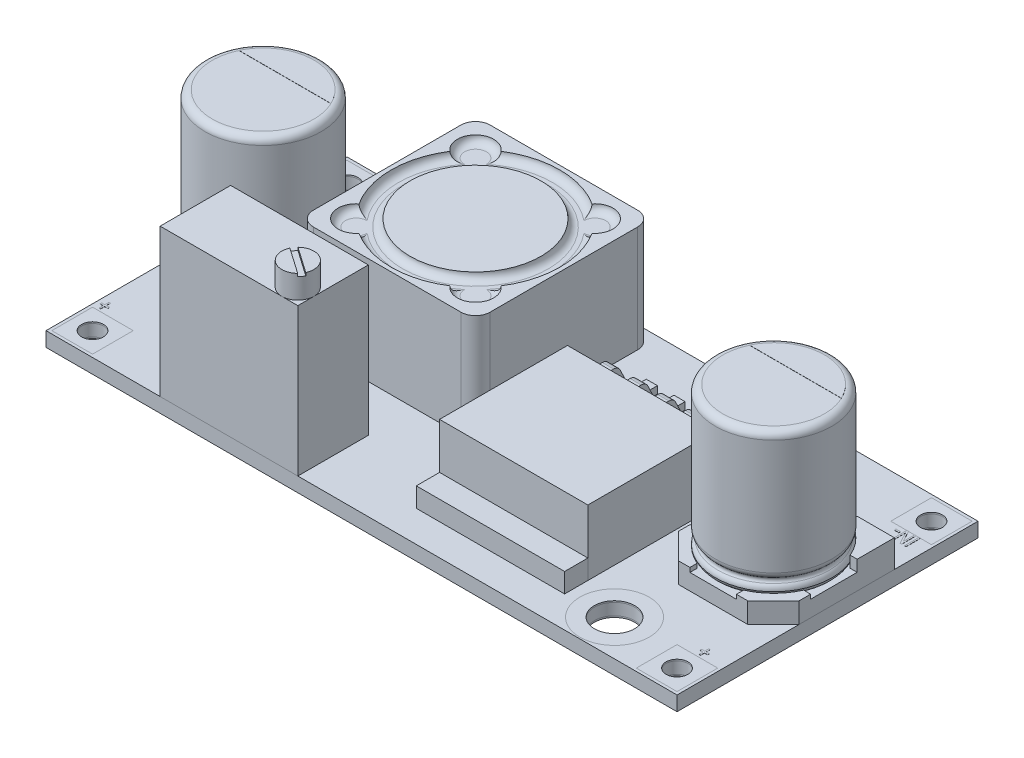
from build123d import *

# Parameters (mm, degrees)
SKETCH1_W                    = 43.4
SKETCH1_H                    = 20.7
BOSS_EXTRUDE1_DEPTH          = 1
SKETCH2_R                    = 0.75
SKETCH2_R_2                  = 1.385
CUT_EXTRUDE1_DEPTH           = 25.062678571
SKETCH2_3_R                  = 2.385
SKETCH2_3_R_2                = 1.385
SKETCH2_3_W                  = 2.8
SKETCH2_3_H                  = 2.8
SKETCH2_3_R_3                = 0.75
CUT_EXTRUDE3_DEPTH           = 0.1
CUT_EXTRUDE4_START           = -0.9
SKETCH2_4_R                  = 2.385
SKETCH2_4_R_2                = 1.385
SKETCH2_4_W                  = 2.8
SKETCH2_4_H                  = 2.8
SKETCH2_4_R_3                = 0.75
CUT_EXTRUDE4_DEPTH           = 0.1
SKETCH2_5_R                  = 2.385
SKETCH2_5_R_2                = 1.385
BOSS_EXTRUDE2_DEPTH          = 0.1
BOSS_EXTRUDE2_2_DEPTH        = 0.1
SKETCH2_5_W                  = 2.8
SKETCH2_5_H                  = 2.8
SKETCH2_5_R_3                = 0.75
BOSS_EXTRUDE2_3_DEPTH        = 0.1
BOSS_EXTRUDE2_4_DEPTH        = 0.1
BOSS_EXTRUDE2_5_DEPTH        = 0.1
BOSS_EXTRUDE2_6_DEPTH        = 0.1
BOSS_EXTRUDE3_START          = -1
SKETCH2_6_R                  = 2.385
SKETCH2_6_R_2                = 1.385
BOSS_EXTRUDE3_DEPTH          = 0.1
BOSS_EXTRUDE3_2_DEPTH        = 0.1
SKETCH2_6_W                  = 2.8
SKETCH2_6_H                  = 2.8
SKETCH2_6_R_3                = 0.75
BOSS_EXTRUDE3_3_DEPTH        = 0.1
BOSS_EXTRUDE3_4_DEPTH        = 0.1
BOSS_EXTRUDE3_5_DEPTH        = 0.1
BOSS_EXTRUDE3_6_DEPTH        = 0.1
SKETCH3_R                    = 4
BOSS_EXTRUDE4_DEPTH          = 1.89
CUT_EXTRUDE5_START           = 1.89
SKETCH3_3_R                  = 4
CUT_EXTRUDE5_DEPTH           = 0.78
CUT_EXTRUDE6_DEPTH           = 0.78
BOSS_EXTRUDE5_START          = 1.11
SKETCH3_4_R                  = 4
BOSS_EXTRUDE5_DEPTH          = 9.92
FILLET1_R                    = 0.5
CUT_EXTRUDE7_DEPTH           = 0.48
SKETCH9_R                    = 0.25
FILLET2_R                    = 0.5
FILLET3_R                    = 0.5
BOSS_EXTRUDE6_DEPTH          = 0.01
BOSS_EXTRUDE7_DEPTH          = 7.32
SKETCH13_R                   = 4.5
CUT_EXTRUDE8_DEPTH           = 0.5
FILLET4_R                    = 0.5
FILLET5_R                    = 0.5
SKETCH14_W                   = 9.47
SKETCH14_H                   = 4.85
BOSS_EXTRUDE8_DEPTH          = 10.15
SKETCH15_R                   = 1.1
BOSS_EXTRUDE9_DEPTH          = 1.6
CUT_EXTRUDE9_DEPTH           = 0.2
SKETCH17_W                   = 10.2
SKETCH17_H                   = 8.8
BOSS_EXTRUDE10_DEPTH         = 4.5
SKETCH17_3_W                 = 10.2
SKETCH17_3_H                 = 1.6
BOSS_EXTRUDE11_DEPTH         = 1.34
EXTRUDE_THIN1_START          = -1.1
EXTRUDE_THIN1_DEPTH          = 0.77
LPATTERN1_COUNT              = 5
LPATTERN1_PITCH              = 1.90375
SKETCH19_W                   = 4.02
SKETCH19_H                   = 2.56
BOSS_EXTRUDE12_DEPTH         = 2.3
EXTRUDE_THIN2_START          = -2
EXTRUDE_THIN2_DEPTH          = 1.4
EXTRUDE_THIN3_START          = -0.6
EXTRUDE_THIN3_DEPTH          = 1.4
BOSS_EXTRUDE13_START         = 6.518831169
BOSS_EXTRUDE13_OUTLINE_W     = 0.103896104
BOSS_EXTRUDE13_OUTLINE_H     = 0.01
BOSS_EXTRUDE13_DEPTH         = 0.662337662
BOSS_EXTRUDE13_START_2       = 6.791558442
BOSS_EXTRUDE13_2_OUTLINE_W   = 0.22077922
BOSS_EXTRUDE13_2_OUTLINE_H   = 0.01
BOSS_EXTRUDE13_2_OUTLINE_W_2 = 0.220779221
BOSS_EXTRUDE13_2_DEPTH       = 0.116883116
BOSS_EXTRUDE13_START_3       = -7.051298701
BOSS_EXTRUDE13_3_OUTLINE_W   = 0.311688311
BOSS_EXTRUDE13_3_OUTLINE_H   = 0.01
BOSS_EXTRUDE13_3_DEPTH       = 0.116883117
BOSS_EXTRUDE13_START_4       = -7.35
BOSS_EXTRUDE13_4_OUTLINE_W   = 0.103896104
BOSS_EXTRUDE13_4_OUTLINE_H   = 0.01
BOSS_EXTRUDE13_4_DEPTH       = 1
BOSS_EXTRUDE13_START_5       = -6.466883117
BOSS_EXTRUDE13_5_OUTLINE_W   = 0.272727273
BOSS_EXTRUDE13_5_OUTLINE_H   = 0.01
BOSS_EXTRUDE13_5_DEPTH       = 0.116883117
BOSS_EXTRUDE13_START_6       = 1
BOSS_EXTRUDE13_6_DEPTH       = 0.01
BOSS_EXTRUDE13_7_DEPTH       = 0.01
BOSS_EXTRUDE13_8_OUTLINE_W   = 0.103896104
BOSS_EXTRUDE13_8_OUTLINE_H   = 0.01
BOSS_EXTRUDE13_8_DEPTH       = 1
BOSS_EXTRUDE13_9_DEPTH       = 0.01
BOSS_EXTRUDE13_10_OUTLINE_W  = 0.311688311
BOSS_EXTRUDE13_10_OUTLINE_H  = 0.01
BOSS_EXTRUDE13_10_DEPTH      = 0.116883117
BOSS_EXTRUDE13_11_OUTLINE_W  = 0.103896104
BOSS_EXTRUDE13_11_OUTLINE_H  = 0.01
BOSS_EXTRUDE13_11_DEPTH      = 0.662337662
BOSS_EXTRUDE13_12_OUTLINE_W  = 0.220779221
BOSS_EXTRUDE13_12_OUTLINE_H  = 0.01
BOSS_EXTRUDE13_12_DEPTH      = 0.116883116


with BuildPart() as part:
    # Sketch1 → Boss-Extrude1 (new body)
    with BuildSketch(Plane(origin=(0, 0, 0), x_dir=(1, 0, 0), z_dir=(0, 1, 0))):
        Rectangle(SKETCH1_W, SKETCH1_H)
    extrude(amount=BOSS_EXTRUDE1_DEPTH)

    # Sketch2 → Cut-Extrude1 (cut, through all)
    with BuildSketch(Plane(origin=(0, 1, 0), x_dir=(1, 0, 0), z_dir=(0, 1, 0))):
        with Locations(Location((-20.1, 8.75, 0), (0, 0, 270))):
            Circle(SKETCH2_R)
        with Locations(Location((-15.415, 7.865, 0), (0, 0, 270))):
            Circle(SKETCH2_R_2)
        with Locations(Location((-20.1, -8.75, 0), (0, 0, 270))):
            Circle(SKETCH2_R)
        with Locations(Location((20.1, 8.75, 0), (0, 0, 270))):
            Circle(SKETCH2_R)
        with Locations(Location((14.915, -7.865, 0), (0, 0, 270))):
            Circle(SKETCH2_R_2)
        with Locations(Location((20.1, -8.75, 0), (0, 0, 270))):
            Circle(SKETCH2_R)
    extrude(amount=-CUT_EXTRUDE1_DEPTH, mode=Mode.SUBTRACT)

    # Sketch2<3> → Cut-Extrude3 (cut)
    # profile 1 of 6: a face of its own
    with BuildSketch(Plane(origin=(0, 1, 0), x_dir=(1, 0, 0), z_dir=(0, 1, 0))):
        with Locations(Location((14.915, -7.865, 0), (0, 0, 270))):
            Circle(SKETCH2_3_R)
        with Locations(Location((14.915, -7.865, 0), (0, 0, 270))):
            Circle(SKETCH2_3_R_2, mode=Mode.SUBTRACT)
    # profile 2 of 6: a face of its own
    with BuildSketch(Plane(origin=(0, 1, 0), x_dir=(1, 0, 0), z_dir=(0, 1, 0))):
        with Locations(Location((-15.415, 7.865, 0), (0, 0, 270))):
            Circle(SKETCH2_3_R)
        with Locations(Location((-15.415, 7.865, 0), (0, 0, 270))):
            Circle(SKETCH2_3_R_2, mode=Mode.SUBTRACT)
    # profile 3 of 6: a face of its own
    with BuildSketch(Plane(origin=(0, 1, 0), x_dir=(1, 0, 0), z_dir=(0, 1, 0))):
        with Locations((-20.1, 8.75)):
            Rectangle(SKETCH2_3_W, SKETCH2_3_H)
        with Locations(Location((-20.1, 8.75, 0), (0, 0, 270))):
            Circle(SKETCH2_3_R_3, mode=Mode.SUBTRACT)
    # profile 4 of 6: a face of its own
    with BuildSketch(Plane(origin=(0, 1, 0), x_dir=(1, 0, 0), z_dir=(0, 1, 0))):
        with Locations((-20.1, -8.75)):
            Rectangle(SKETCH2_3_W, SKETCH2_3_H)
        with Locations(Location((-20.1, -8.75, 0), (0, 0, 270))):
            Circle(SKETCH2_3_R_3, mode=Mode.SUBTRACT)
    # profile 5 of 6: a face of its own
    with BuildSketch(Plane(origin=(0, 1, 0), x_dir=(1, 0, 0), z_dir=(0, 1, 0))):
        with Locations((20.1, -8.75)):
            Rectangle(SKETCH2_3_W, SKETCH2_3_H)
        with Locations(Location((20.1, -8.75, 0), (0, 0, 270))):
            Circle(SKETCH2_3_R_3, mode=Mode.SUBTRACT)
    # profile 6 of 6: a face of its own
    with BuildSketch(Plane(origin=(0, 1, 0), x_dir=(1, 0, 0), z_dir=(0, 1, 0))):
        with Locations((20.1, 8.75)):
            Rectangle(SKETCH2_3_W, SKETCH2_3_H)
        with Locations(Location((20.1, 8.75, 0), (0, 0, 270))):
            Circle(SKETCH2_3_R_3, mode=Mode.SUBTRACT)
    extrude(amount=-CUT_EXTRUDE3_DEPTH, mode=Mode.SUBTRACT)

    # Sketch2<4> → Cut-Extrude4 (cut)
    # profile 1 of 6: a face of its own
    with BuildSketch(Plane(origin=(0, 1, 0), x_dir=(1, 0, 0), z_dir=(0, 1, 0)).offset(CUT_EXTRUDE4_START)):
        with Locations(Location((14.915, -7.865, 0), (0, 0, 270))):
            Circle(SKETCH2_4_R)
        with Locations(Location((14.915, -7.865, 0), (0, 0, 270))):
            Circle(SKETCH2_4_R_2, mode=Mode.SUBTRACT)
    # profile 2 of 6: a face of its own
    with BuildSketch(Plane(origin=(0, 1, 0), x_dir=(1, 0, 0), z_dir=(0, 1, 0)).offset(CUT_EXTRUDE4_START)):
        with Locations(Location((-15.415, 7.865, 0), (0, 0, 270))):
            Circle(SKETCH2_4_R)
        with Locations(Location((-15.415, 7.865, 0), (0, 0, 270))):
            Circle(SKETCH2_4_R_2, mode=Mode.SUBTRACT)
    # profile 3 of 6: a face of its own
    with BuildSketch(Plane(origin=(0, 1, 0), x_dir=(1, 0, 0), z_dir=(0, 1, 0)).offset(CUT_EXTRUDE4_START)):
        with Locations((-20.1, 8.75)):
            Rectangle(SKETCH2_4_W, SKETCH2_4_H)
        with Locations(Location((-20.1, 8.75, 0), (0, 0, 270))):
            Circle(SKETCH2_4_R_3, mode=Mode.SUBTRACT)
    # profile 4 of 6: a face of its own
    with BuildSketch(Plane(origin=(0, 1, 0), x_dir=(1, 0, 0), z_dir=(0, 1, 0)).offset(CUT_EXTRUDE4_START)):
        with Locations((-20.1, -8.75)):
            Rectangle(SKETCH2_4_W, SKETCH2_4_H)
        with Locations(Location((-20.1, -8.75, 0), (0, 0, 270))):
            Circle(SKETCH2_4_R_3, mode=Mode.SUBTRACT)
    # profile 5 of 6: a face of its own
    with BuildSketch(Plane(origin=(0, 1, 0), x_dir=(1, 0, 0), z_dir=(0, 1, 0)).offset(CUT_EXTRUDE4_START)):
        with Locations((20.1, -8.75)):
            Rectangle(SKETCH2_4_W, SKETCH2_4_H)
        with Locations(Location((20.1, -8.75, 0), (0, 0, 270))):
            Circle(SKETCH2_4_R_3, mode=Mode.SUBTRACT)
    # profile 6 of 6: a face of its own
    with BuildSketch(Plane(origin=(0, 1, 0), x_dir=(1, 0, 0), z_dir=(0, 1, 0)).offset(CUT_EXTRUDE4_START)):
        with Locations((20.1, 8.75)):
            Rectangle(SKETCH2_4_W, SKETCH2_4_H)
        with Locations(Location((20.1, 8.75, 0), (0, 0, 270))):
            Circle(SKETCH2_4_R_3, mode=Mode.SUBTRACT)
    extrude(amount=-CUT_EXTRUDE4_DEPTH, mode=Mode.SUBTRACT)


with BuildPart() as body_2:
    # Sketch2<5> → Boss-Extrude2 (new body)
    with BuildSketch(Plane(origin=(0, 1, 0), x_dir=(1, 0, 0), z_dir=(0, 1, 0))):
        with Locations(Location((14.915, -7.865, 0), (0, 0, 270))):
            Circle(SKETCH2_5_R)
        with Locations(Location((14.915, -7.865, 0), (0, 0, 270))):
            Circle(SKETCH2_5_R_2, mode=Mode.SUBTRACT)
    extrude(amount=-BOSS_EXTRUDE2_DEPTH)


with BuildPart() as body_3:
    # Sketch2<5> → Boss-Extrude2 2 (new body)
    with BuildSketch(Plane(origin=(0, 1, 0), x_dir=(1, 0, 0), z_dir=(0, 1, 0))):
        with Locations(Location((-15.415, 7.865, 0), (0, 0, 270))):
            Circle(SKETCH2_5_R)
        with Locations(Location((-15.415, 7.865, 0), (0, 0, 270))):
            Circle(SKETCH2_5_R_2, mode=Mode.SUBTRACT)
    extrude(amount=-BOSS_EXTRUDE2_2_DEPTH)


with BuildPart() as body_4:
    # Sketch2<5> → Boss-Extrude2 3 (new body)
    with BuildSketch(Plane(origin=(0, 1, 0), x_dir=(1, 0, 0), z_dir=(0, 1, 0))):
        with Locations((-20.1, 8.75)):
            Rectangle(SKETCH2_5_W, SKETCH2_5_H)
        with Locations(Location((-20.1, 8.75, 0), (0, 0, 270))):
            Circle(SKETCH2_5_R_3, mode=Mode.SUBTRACT)
    extrude(amount=-BOSS_EXTRUDE2_3_DEPTH)


with BuildPart() as body_5:
    # Sketch2<5> → Boss-Extrude2 4 (new body)
    with BuildSketch(Plane(origin=(0, 1, 0), x_dir=(1, 0, 0), z_dir=(0, 1, 0))):
        with Locations((-20.1, -8.75)):
            Rectangle(SKETCH2_5_W, SKETCH2_5_H)
        with Locations(Location((-20.1, -8.75, 0), (0, 0, 270))):
            Circle(SKETCH2_5_R_3, mode=Mode.SUBTRACT)
    extrude(amount=-BOSS_EXTRUDE2_4_DEPTH)


with BuildPart() as body_6:
    # Sketch2<5> → Boss-Extrude2 5 (new body)
    with BuildSketch(Plane(origin=(0, 1, 0), x_dir=(1, 0, 0), z_dir=(0, 1, 0))):
        with Locations((20.1, -8.75)):
            Rectangle(SKETCH2_5_W, SKETCH2_5_H)
        with Locations(Location((20.1, -8.75, 0), (0, 0, 270))):
            Circle(SKETCH2_5_R_3, mode=Mode.SUBTRACT)
    extrude(amount=-BOSS_EXTRUDE2_5_DEPTH)


with BuildPart() as body_7:
    # Sketch2<5> → Boss-Extrude2 6 (new body)
    with BuildSketch(Plane(origin=(0, 1, 0), x_dir=(1, 0, 0), z_dir=(0, 1, 0))):
        with Locations((20.1, 8.75)):
            Rectangle(SKETCH2_5_W, SKETCH2_5_H)
        with Locations(Location((20.1, 8.75, 0), (0, 0, 270))):
            Circle(SKETCH2_5_R_3, mode=Mode.SUBTRACT)
    extrude(amount=-BOSS_EXTRUDE2_6_DEPTH)


with BuildPart() as body_8:
    # Sketch2<6> → Boss-Extrude3 (new body)
    with BuildSketch(Plane(origin=(0, 1, 0), x_dir=(1, 0, 0), z_dir=(0, 1, 0)).offset(BOSS_EXTRUDE3_START)):
        with Locations(Location((14.915, -7.865, 0), (0, 0, 270))):
            Circle(SKETCH2_6_R)
        with Locations(Location((14.915, -7.865, 0), (0, 0, 270))):
            Circle(SKETCH2_6_R_2, mode=Mode.SUBTRACT)
    extrude(amount=BOSS_EXTRUDE3_DEPTH)


with BuildPart() as body_9:
    # Sketch2<6> → Boss-Extrude3 2 (new body)
    with BuildSketch(Plane(origin=(0, 1, 0), x_dir=(1, 0, 0), z_dir=(0, 1, 0)).offset(BOSS_EXTRUDE3_START)):
        with Locations(Location((-15.415, 7.865, 0), (0, 0, 270))):
            Circle(SKETCH2_6_R)
        with Locations(Location((-15.415, 7.865, 0), (0, 0, 270))):
            Circle(SKETCH2_6_R_2, mode=Mode.SUBTRACT)
    extrude(amount=BOSS_EXTRUDE3_2_DEPTH)


with BuildPart() as body_10:
    # Sketch2<6> → Boss-Extrude3 3 (new body)
    with BuildSketch(Plane(origin=(0, 1, 0), x_dir=(1, 0, 0), z_dir=(0, 1, 0)).offset(BOSS_EXTRUDE3_START)):
        with Locations((-20.1, 8.75)):
            Rectangle(SKETCH2_6_W, SKETCH2_6_H)
        with Locations(Location((-20.1, 8.75, 0), (0, 0, 270))):
            Circle(SKETCH2_6_R_3, mode=Mode.SUBTRACT)
    extrude(amount=BOSS_EXTRUDE3_3_DEPTH)


with BuildPart() as body_11:
    # Sketch2<6> → Boss-Extrude3 4 (new body)
    with BuildSketch(Plane(origin=(0, 1, 0), x_dir=(1, 0, 0), z_dir=(0, 1, 0)).offset(BOSS_EXTRUDE3_START)):
        with Locations((-20.1, -8.75)):
            Rectangle(SKETCH2_6_W, SKETCH2_6_H)
        with Locations(Location((-20.1, -8.75, 0), (0, 0, 270))):
            Circle(SKETCH2_6_R_3, mode=Mode.SUBTRACT)
    extrude(amount=BOSS_EXTRUDE3_4_DEPTH)


with BuildPart() as body_12:
    # Sketch2<6> → Boss-Extrude3 5 (new body)
    with BuildSketch(Plane(origin=(0, 1, 0), x_dir=(1, 0, 0), z_dir=(0, 1, 0)).offset(BOSS_EXTRUDE3_START)):
        with Locations((20.1, -8.75)):
            Rectangle(SKETCH2_6_W, SKETCH2_6_H)
        with Locations(Location((20.1, -8.75, 0), (0, 0, 270))):
            Circle(SKETCH2_6_R_3, mode=Mode.SUBTRACT)
    extrude(amount=BOSS_EXTRUDE3_5_DEPTH)


with BuildPart() as body_13:
    # Sketch2<6> → Boss-Extrude3 6 (new body)
    with BuildSketch(Plane(origin=(0, 1, 0), x_dir=(1, 0, 0), z_dir=(0, 1, 0)).offset(BOSS_EXTRUDE3_START)):
        with Locations((20.1, 8.75)):
            Rectangle(SKETCH2_6_W, SKETCH2_6_H)
        with Locations(Location((20.1, 8.75, 0), (0, 0, 270))):
            Circle(SKETCH2_6_R_3, mode=Mode.SUBTRACT)
    extrude(amount=BOSS_EXTRUDE3_6_DEPTH)


with BuildPart() as body_14:
    # Sketch3 → Boss-Extrude4 (new body)
    # profile 1 of 2: a face of its own
    with BuildSketch(Plane(origin=(0, 1, 0), x_dir=(1, 0, 0), z_dir=(0, 1, 0))):
        Polygon((21.7, 4.6), (13.41, 4.6), (13.41, -1.952233047), (15.177766953, -3.72), (19.932233047, -3.72), (21.7, -1.952233047), align=None)
        with Locations((17.555, 0.44)):
            Circle(SKETCH3_R, mode=Mode.SUBTRACT)
    # profile 2 of 2: a face of its own
    with BuildSketch(Plane(origin=(0, 1, 0), x_dir=(1, 0, 0), z_dir=(0, 1, 0))):
        with Locations((17.555, 0.44)):
            Circle(SKETCH3_R)
    extrude(amount=BOSS_EXTRUDE4_DEPTH)

    # Sketch3<3> → Cut-Extrude5 (cut)
    with BuildSketch(Plane(origin=(0, 1, 0), x_dir=(1, 0, 0), z_dir=(0, 1, 0)).offset(CUT_EXTRUDE5_START)):
        with Locations(Location((17.555, 0.44, 0), (0, 0, 270))):
            Circle(SKETCH3_3_R)
    extrude(amount=-CUT_EXTRUDE5_DEPTH, mode=Mode.SUBTRACT)

    # Sketch4 → Cut-Extrude6 (cut)
    with BuildSketch(Plane(origin=(0, 2.89, 0), x_dir=(1, 0, 0), z_dir=(0, 1, 0))):
        Polygon((15.955, 4.6), (19.155, 4.6), (19.155, 2.04), (21.7, 2.04), (21.7, -1.16), (19.155, -1.16), (19.155, -3.72), (15.955, -3.72), (15.955, -1.16), (13.41, -1.16), (13.41, 2.04), (15.955, 2.04), align=None)
    extrude(amount=-CUT_EXTRUDE6_DEPTH, mode=Mode.SUBTRACT)

    # Sketch5 → Cut-Extrude7 (cut)
    with BuildSketch(Plane(origin=(0, 2.89, 0), x_dir=(1, 0, 0), z_dir=(0, 1, 0))):
        with BuildLine():
            Line((19.155, -3.226060556), (19.155, -3.72))
            Line((19.155, -3.72), (19.932233047, -3.72))
            Line((19.932233047, -3.72), (21.7, -1.952233047))
            Line((21.7, -1.952233047), (21.7, -1.16))
            Line((21.7, -1.16), (21.221060556, -1.16))
            ThreePointArc((21.221060556, -1.16), (20.383427125, -2.388427125), (19.155, -3.226060556))
        make_face()
        with BuildLine():
            Line((13.888939444, -1.16), (13.41, -1.16))
            Line((13.41, -1.16), (13.41, -1.952233047))
            Line((13.41, -1.952233047), (15.177766953, -3.72))
            Line((15.177766953, -3.72), (15.955, -3.72))
            Line((15.955, -3.72), (15.955, -3.226060556))
            ThreePointArc((15.955, -3.226060556), (14.726572875, -2.388427125), (13.888939444, -1.16))
        make_face()
    extrude(amount=-CUT_EXTRUDE7_DEPTH, mode=Mode.SUBTRACT)


with BuildPart() as body_15:
    # Sketch3<4> → Boss-Extrude5 (new body)
    with BuildSketch(Plane(origin=(0, 1, 0), x_dir=(1, 0, 0), z_dir=(0, 1, 0)).offset(BOSS_EXTRUDE5_START)):
        with Locations(Location((17.555, 0.44, 0), (0, 0, 270))):
            Circle(SKETCH3_4_R)
    extrude(amount=BOSS_EXTRUDE5_DEPTH)

    # Fillet1
    fillet1_edges = [body_15.edges().sort_by_distance(p)[0] for p in [
        (17.555, 12.03, -4.44),
    ]]
    fillet(fillet1_edges, radius=FILLET1_R)

    # Cut-Sweep2: sweep along a path in Sketch10
    with BuildLine(Plane(origin=(0, 3.065409261, 0), x_dir=(1, 0, 0), z_dir=(0, 1, 0))) as cut_sweep2_path:
        CenterArc((17.555, 0.44), 4, 0, 360)
    # Sketch9 → Cut-Sweep2 (sweep, cut)
    with BuildSketch(Plane.XY.offset(-0.44)):
        with Locations((21.555, 3.065409261)):
            Circle(SKETCH9_R)
    sweep(path=cut_sweep2_path.line, mode=Mode.SUBTRACT)

    # Fillet2
    fillet2_edges = [body_15.edges().sort_by_distance(p)[0] for p in [
        (14.726572875, 2.815409261, -3.268427125),
        (14.726572875, 3.315409261, -3.268427125),
    ]]
    fillet(fillet2_edges, radius=FILLET2_R)

    # Fillet3
    # the kernel refuses this fillet: 0.5 mm, written as the material it takes off along each edge
    with BuildSketch(Plane(origin=(17.555, 2.11, -0.44), x_dir=(0, 0, 1), z_dir=(-1, 0, 0))) as fillet3_piece_1:
        with BuildLine():
            CenterArc((3.51085125, 0.5), FILLET3_R, 270, 78.040778801)
            Line((3.51085125, 0), (3.51085125, -0.01))
            Line((3.51085125, -0.01), (4, -0.01))
            Line((4, -0.01), (4.01, 0))
            ThreePointArc((4.01, 0), (4.01, 0.198196133), (4.009781868, 0.394320112))
            Line((4.009781868, 0.394320112), (3.999998914, 0.396392267))
        make_face()
    fillet3_piece_1_solid = revolve(axis=Axis((17.555, 2.11, -0.44), (0, 1, 0)), revolution_arc=89.999998435, mode=Mode.PRIVATE)
    with BuildSketch(Plane(origin=(17.555, 2.11, -0.44), x_dir=(0.9999999999999997, 0, 2.7307804489895576e-08), z_dir=(-2.7307804489895576e-08, 0, 0.9999999999999997))) as fillet3_piece_2:
        with BuildLine():
            CenterArc((3.510844986, 0.5), FILLET3_R, 270, 78.040778801)
            Line((3.510844986, 0), (3.510844986, -0.01))
            Line((3.510844986, -0.01), (4, -0.01))
            Line((4, -0.01), (4.01, 0))
            ThreePointArc((4.01, 0), (4.01, 0.198196133), (4.009775603, 0.394320112))
            Line((4.009775603, 0.394320112), (3.99999265, 0.396392267))
        make_face()
    fillet3_piece_2_solid = revolve(axis=Axis((17.555, 2.11, -0.44), (0, 1, 0)), revolution_arc=270.000001565, mode=Mode.PRIVATE)
    add([fillet3_piece_1_solid, fillet3_piece_2_solid], mode=Mode.SUBTRACT)


with BuildPart() as body_16:
    # Sketch11 → Boss-Extrude6 (new body)
    with BuildSketch(Plane(origin=(0, 12.03, 0), x_dir=(1, 0, 0), z_dir=(0, 1, 0))):
        with BuildLine():
            Line((14.39272234, 1.94), (20.71727766, 1.94))
            ThreePointArc((20.71727766, 1.94), (17.555, 3.94), (14.39272234, 1.94))
        make_face()
    extrude(amount=BOSS_EXTRUDE6_DEPTH)


with BuildPart() as body_17:
    # Mirror1: mirrored copy
    add(body_14.part.mirror(Plane(origin=(0, 0, 0), x_dir=(0, 0, 1), z_dir=(1, 0, 0))))


with BuildPart() as body_18:
    # Mirror2: mirrored copy
    add(body_15.part.mirror(Plane(origin=(0, 0, 0), x_dir=(0, 0, 1), z_dir=(1, 0, 0))))


with BuildPart() as body_19:
    # Mirror2 2: mirrored copy
    add(body_16.part.mirror(Plane(origin=(0, 0, 0), x_dir=(0, 0, 1), z_dir=(1, 0, 0))))


with BuildPart() as body_20:
    # Sketch12 → Boss-Extrude7 (new body)
    with BuildSketch(Plane(origin=(0, 1, 0), x_dir=(1, 0, 0), z_dir=(0, 1, 0))):
        with BuildLine():
            Line((-11.36, 9.85), (-1.21, 9.85))
            ThreePointArc((-1.21, 9.85), (-0.502893219, 9.557106781), (-0.21, 8.85))
            Line((-0.21, 8.85), (-0.21, -1.3))
            ThreePointArc((-0.21, -1.3), (-0.502893219, -2.007106781), (-1.21, -2.3))
            Line((-1.21, -2.3), (-11.36, -2.3))
            ThreePointArc((-11.36, -2.3), (-12.067106781, -2.007106781), (-12.36, -1.3))
            Line((-12.36, -1.3), (-12.36, 8.85))
            ThreePointArc((-12.36, 8.85), (-12.067106781, 9.557106781), (-11.36, 9.85))
        make_face()
    extrude(amount=BOSS_EXTRUDE7_DEPTH)

    # Sketch13 → Cut-Extrude8 (cut)
    with BuildSketch(Plane(origin=(0, 8.32, 0), x_dir=(1, 0, 0), z_dir=(0, 1, 0))):
        with BuildLine():
            ThreePointArc((-1.400290034, 6.902236567), (-1.299897193, 8.760102807), (-3.157763433, 8.659709966))
            ThreePointArc((-3.157763433, 8.659709966), (-6.285, 9.575), (-9.412236567, 8.659709966))
            ThreePointArc((-9.412236567, 8.659709966), (-11.270102807, 8.760102807), (-11.169709966, 6.902236567))
            ThreePointArc((-11.169709966, 6.902236567), (-12.085, 3.775), (-11.169709966, 0.647763433))
            ThreePointArc((-11.169709966, 0.647763433), (-11.270102807, -1.210102807), (-9.412236567, -1.109709966))
            ThreePointArc((-9.412236567, -1.109709966), (-6.285, -2.025), (-3.157763433, -1.109709966))
            ThreePointArc((-3.157763433, -1.109709966), (-1.299897193, -1.210102807), (-1.400290034, 0.647763433))
            ThreePointArc((-1.400290034, 0.647763433), (-0.485, 3.775), (-1.400290034, 6.902236567))
        make_face()
        with Locations(Location((-6.285, 3.775, 0), (0, 0, 270))):
            Circle(SKETCH13_R, mode=Mode.SUBTRACT)
    extrude(amount=-CUT_EXTRUDE8_DEPTH, mode=Mode.SUBTRACT)

    # Fillet4
    fillet4_edges = [body_20.edges().sort_by_distance(p)[0] for p in [
        (-6.285, 7.82, -8.275),
    ]]
    fillet(fillet4_edges, radius=FILLET4_R - 0.0001)  # a hair under: the kernel refuses the full size

    # Fillet5
    fillet5_edges = [body_20.edges().sort_by_distance(p)[0] for p in [
        (-6.285, 7.82, 2.025),
        (-1.299897193, 7.82, 1.210102807),
        (-11.270102807, 7.82, 1.210102807),
        (-12.085, 7.82, -3.775),
        (-11.270102807, 7.82, -8.760102807),
        (-6.285, 7.82, -9.575),
        (-1.299897193, 7.82, -8.760102807),
        (-0.485, 7.82, -3.775),
    ]]
    fillet(fillet5_edges, radius=FILLET5_R - 0.0001)  # a hair under: the kernel refuses the full size


with BuildPart() as body_21:
    # Sketch14 → Boss-Extrude8 (new body)
    with BuildSketch(Plane(origin=(0, 1, 0), x_dir=(1, 0, 0), z_dir=(0, 1, 0))):
        with Locations((-9.115, -7.925)):
            Rectangle(SKETCH14_W, SKETCH14_H)
    extrude(amount=BOSS_EXTRUDE8_DEPTH)


with BuildPart() as body_22:
    # Sketch15 → Boss-Extrude9 (new body)
    with BuildSketch(Plane(origin=(0, 11.15, 0), x_dir=(1, 0, 0), z_dir=(0, 1, 0))):
        with Locations(Location((-5.48, -9.25, 0), (0, 0, 270))):
            Circle(SKETCH15_R)
    extrude(amount=BOSS_EXTRUDE9_DEPTH)

    # Sketch16 → Cut-Extrude9 (cut)
    with BuildSketch(Plane(origin=(0, 12.75, 0), x_dir=(1, 0, 0), z_dir=(0, 1, 0))):
        with BuildLine():
            Line((-6.481845846, -8.795792008), (-4.70680547, -10.032413074))
            ThreePointArc((-4.70680547, -10.032413074), (-4.577436025, -9.878791119), (-4.478154154, -9.704207992))
            Line((-4.478154154, -9.704207992), (-6.25319453, -8.467586926))
            ThreePointArc((-6.25319453, -8.467586926), (-6.382563975, -8.621208881), (-6.481845846, -8.795792008))
        make_face()
    extrude(amount=-CUT_EXTRUDE9_DEPTH, mode=Mode.SUBTRACT)


with BuildPart() as body_23:
    # Sketch17 → Boss-Extrude10 (new body)
    with BuildSketch(Plane(origin=(0, 1, 0), x_dir=(1, 0, 0), z_dir=(0, 1, 0))):
        with Locations((6.717868164, -2.2)):
            Rectangle(SKETCH17_W, SKETCH17_H)
    extrude(amount=BOSS_EXTRUDE10_DEPTH)


with BuildPart() as body_24:
    # Sketch17<3> → Boss-Extrude11 (new body)
    with BuildSketch(Plane(origin=(0, 1, 0), x_dir=(1, 0, 0), z_dir=(0, 1, 0))):
        with Locations((6.717868164, -7.4)):
            Rectangle(SKETCH17_3_W, SKETCH17_3_H)
    extrude(amount=BOSS_EXTRUDE11_DEPTH)


with BuildPart() as body_25:
    # Sketch18 → Extrude-Thin1 (new body)
    with BuildSketch(Plane(origin=(11.817868164, 0, 0), x_dir=(0, 0, -1), z_dir=(1, 0, 0)).offset(EXTRUDE_THIN1_START)):
        with BuildLine():
            Line((2.2, 4), (3.885383015, 4))
            ThreePointArc((3.885383015, 4), (4.151669734, 3.923191899), (4.336144544, 3.716365534))
            Line((4.336144544, 3.716365534), (5.263855456, 1.783634466))
            ThreePointArc((5.263855456, 1.783634466), (5.448330266, 1.576808101), (5.714616985, 1.5))
            Line((5.714616985, 1.5), (6.9, 1.5))
            Line((6.9, 1.5), (6.9, 1))
            Line((6.9, 1), (5.714616985, 1))
            ThreePointArc((5.714616985, 1), (5.182043548, 1.153616202), (4.813093927, 1.567268932))
            Line((4.813093927, 1.567268932), (3.885383015, 3.5))
            Line((3.885383015, 3.5), (2.2, 3.5))
            Line((2.2, 3.5), (2.2, 4))
        make_face()
    extrude_thin1 = extrude(amount=-EXTRUDE_THIN1_DEPTH)


with BuildPart() as lpattern1_1:
    # LPattern1: Extrude-Thin1 ×5
    with Locations(*[(-i * LPATTERN1_PITCH, 0, 0) for i in range(1, LPATTERN1_COUNT)]):
        add(extrude_thin1)


with BuildPart() as body_30:
    # Sketch19 → Boss-Extrude12 (new body)
    with BuildSketch(Plane(origin=(0, 1, 0), x_dir=(1, 0, 0), z_dir=(0, 1, 0))):
        with Locations((7.89, 9.07)):
            Rectangle(SKETCH19_W, SKETCH19_H)
    extrude(amount=BOSS_EXTRUDE12_DEPTH)


with BuildPart() as body_31:
    # Extrude-Thin2: read off the stored shape, not the designer's step
    # Extrude-Thin2 outline → Extrude-Thin2 (new body)
    with BuildSketch(Plane(origin=(0, 0, -10.35), x_dir=(-1, 0, 0), z_dir=(0, 0, -1)).offset(EXTRUDE_THIN2_START)):
        Polygon((-5.88, 2.618115353), (-6.06789915, 2.549603242), (-5.47789915, 0.931487889), (-5.29, 1), align=None)
    extrude(amount=EXTRUDE_THIN2_DEPTH)


with BuildPart() as body_32:
    # Sketch20<3> → Extrude-Thin3 (new body)
    with BuildSketch(Plane(origin=(0, 0, -10.35), x_dir=(-1, 0, 0), z_dir=(0, 0, -1)).offset(EXTRUDE_THIN3_START)):
        Polygon((-9.9, 2.544944431), (-10.49, 1), (-10.303160842, 0.928647852), (-9.713160842, 2.473592283), align=None)
    extrude(amount=-EXTRUDE_THIN3_DEPTH)


with BuildPart() as body_33:
    # Boss-Extrude13: read off the stored shape, not the designer's step
    # Boss-Extrude13 outline → Boss-Extrude13 (new body)
    with BuildSketch(Plane.XY.offset(BOSS_EXTRUDE13_START)):
        with Locations((-21.162337662, 1.005)):
            Rectangle(BOSS_EXTRUDE13_OUTLINE_W, BOSS_EXTRUDE13_OUTLINE_H)
    extrude(amount=BOSS_EXTRUDE13_DEPTH)

    # Boss-Extrude13 2 outline → Boss-Extrude13 2 (add)
    with BuildSketch(Plane.XY.offset(BOSS_EXTRUDE13_START_2)):
        with Locations((-21, 1.005)):
            Rectangle(BOSS_EXTRUDE13_2_OUTLINE_W, BOSS_EXTRUDE13_2_OUTLINE_H)
        with Locations((-21.324675324, 1.005)):
            Rectangle(BOSS_EXTRUDE13_2_OUTLINE_W_2, BOSS_EXTRUDE13_2_OUTLINE_H)
    extrude(amount=BOSS_EXTRUDE13_2_DEPTH)


with BuildPart() as body_34:
    # Boss-Extrude13 3 outline → Boss-Extrude13 3 (new body)
    with BuildSketch(Plane.XY.offset(BOSS_EXTRUDE13_START_3)):
        with Locations((-21.323376624, 1.005)):
            Rectangle(BOSS_EXTRUDE13_3_OUTLINE_W, BOSS_EXTRUDE13_3_OUTLINE_H)
    extrude(amount=BOSS_EXTRUDE13_3_DEPTH)


with BuildPart() as body_35:
    # Boss-Extrude13 4 outline → Boss-Extrude13 4 (new body)
    with BuildSketch(Plane.XY.offset(BOSS_EXTRUDE13_START_4)):
        with Locations((-20.777922078, 1.005)):
            Rectangle(BOSS_EXTRUDE13_4_OUTLINE_W, BOSS_EXTRUDE13_4_OUTLINE_H)
    extrude(amount=BOSS_EXTRUDE13_4_DEPTH)

    # Boss-Extrude13 5 outline → Boss-Extrude13 5 (add)
    with BuildSketch(Plane.XY.offset(BOSS_EXTRUDE13_START_5)):
        with Locations((-20.966233767, 1.005)):
            Rectangle(BOSS_EXTRUDE13_5_OUTLINE_W, BOSS_EXTRUDE13_5_OUTLINE_H)
        with Locations((-20.58961039, 1.005)):
            Rectangle(BOSS_EXTRUDE13_5_OUTLINE_W, BOSS_EXTRUDE13_5_OUTLINE_H)
    extrude(amount=BOSS_EXTRUDE13_5_DEPTH)


with BuildPart() as body_36:
    # Boss-Extrude13 6 outline → Boss-Extrude13 6 (new body)
    with BuildSketch(Plane(origin=(0, 0, 0), x_dir=(1, 0, 0), z_dir=(0, 1, 0)).offset(BOSS_EXTRUDE13_START_6)):
        with BuildLine():
            Line((-20.323376623, 6.35), (-20.219480519, 6.35))
            Line((-20.219480519, 6.35), (-20.219480519, 6.926095779))
            add(Edge.make_bspline(
                [(-19.998701299, 7.246103896), (-20.008043829, 7.245918892), (-20.026172672, 7.245559898), (-20.052329089, 7.242529741), (-20.076515598, 7.237449637), (-20.098795711, 7.230478102), (-20.118948402, 7.22102788), (-20.137339796, 7.209829147), (-20.153548617, 7.196394509), (-20.168054734, 7.180800183), (-20.180431412, 7.162029064), (-20.190824304, 7.139600901), (-20.200014283, 7.113475004), (-20.207047295, 7.083374506), (-20.21271971, 7.049485407), (-20.216620583, 7.011804015), (-20.219075736, 6.970230315), (-20.219341521, 6.941251125), (-20.219480519, 6.926095779)],
                knots=[0, 0, 0, 0, 0.062113223, 0.120528462, 0.174783076, 0.226276906, 0.275379403, 0.322438959, 0.369088299, 0.414928263, 0.463581646, 0.517903342, 0.578932195, 0.647443793, 0.723165437, 0.80731063, 0.899228585, 1, 1, 1, 1], degree=3))
            add(Edge.make_bspline(
                [(-19.790909091, 6.926095779), (-19.790997617, 6.936986677), (-19.791168661, 6.958029226), (-19.792171994, 6.988409712), (-19.79379809, 7.016488102), (-19.795883864, 7.042160787), (-19.798999105, 7.065502676), (-19.802581252, 7.086499872), (-19.806690019, 7.105268946), (-19.813479093, 7.126647792), (-19.82333474, 7.150586965), (-19.839247705, 7.17578171), (-19.858498746, 7.197433659), (-19.881255529, 7.21516335), (-19.906926341, 7.229068457), (-19.93519751, 7.239024047), (-19.966119452, 7.245005306), (-19.987580622, 7.245728931), (-19.998701299, 7.246103896)],
                knots=[0, 0, 0, 0, 0.074515231, 0.143972559, 0.207945053, 0.266939666, 0.320152675, 0.368998592, 0.412670547, 0.451459569, 0.522375526, 0.589141165, 0.654361981, 0.719630395, 0.785485199, 0.853256948, 0.923961178, 1, 1, 1, 1], degree=3))
            Line((-19.790909091, 6.926095779), (-19.790909091, 6.35))
            Line((-19.790909091, 6.35), (-19.687012987, 6.35))
            Line((-19.687012987, 6.35), (-19.687012987, 6.925487013))
            add(Edge.make_bspline(
                [(-20.00661526, 7.362987013), (-19.993679278, 7.362770098), (-19.968528578, 7.362348364), (-19.93214149, 7.357492389), (-19.898177727, 7.350132531), (-19.866723007, 7.339543649), (-19.837695703, 7.325985743), (-19.811349459, 7.309137957), (-19.787288917, 7.289593411), (-19.765953743, 7.266488397), (-19.746953724, 7.239650029), (-19.730742333, 7.208292616), (-19.717392868, 7.172293442), (-19.705948575, 7.131886692), (-19.697418828, 7.086787152), (-19.691569762, 7.037081567), (-19.687561011, 6.982843664), (-19.687200485, 6.945110748), (-19.687012987, 6.925487013)],
                knots=[0, 0, 0, 0, 0.062176329, 0.120885928, 0.176212903, 0.229089883, 0.28016803, 0.329893984, 0.379128015, 0.428848649, 0.480658114, 0.536824172, 0.598087449, 0.665025901, 0.738587452, 0.818561318, 0.905639297, 1, 1, 1, 1], degree=3))
            add(Edge.make_bspline(
                [(-20.323376623, 6.925487013), (-20.32332678, 6.937258556), (-20.323229059, 6.960337248), (-20.321643595, 6.994090903), (-20.31977005, 7.026249091), (-20.316767089, 7.056719969), (-20.312560853, 7.085577118), (-20.308125, 7.112922441), (-20.302331479, 7.138551101), (-20.295940642, 7.162664068), (-20.288226215, 7.185346194), (-20.279019426, 7.206756217), (-20.268569293, 7.227050843), (-20.256483446, 7.246013121), (-20.243078676, 7.263819302), (-20.227986601, 7.280173574), (-20.211703493, 7.29550889), (-20.194023573, 7.309548778), (-20.174943601, 7.3221037), (-20.154625984, 7.333160654), (-20.132924378, 7.342186447), (-20.110147899, 7.350049042), (-20.086015677, 7.35586081), (-20.060622846, 7.35979728), (-20.03407252, 7.362616168), (-20.01588982, 7.362861748), (-20.00661526, 7.362987013)],
                knots=[0, 0, 0, 0, 0.057008156, 0.111767307, 0.163633486, 0.213020299, 0.260000281, 0.30486511, 0.347151105, 0.387205539, 0.425642334, 0.463067549, 0.499993297, 0.536075202, 0.571850911, 0.60779423, 0.643719629, 0.680097778, 0.71698863, 0.754221205, 0.791947764, 0.830694655, 0.870821373, 0.911970204, 0.955098107, 1, 1, 1, 1], degree=3))
            Line((-20.323376623, 6.925487013), (-20.323376623, 6.35))
        make_face()
    extrude(amount=BOSS_EXTRUDE13_6_DEPTH)


with BuildPart() as body_37:
    # Boss-Extrude13 7 outline → Boss-Extrude13 7 (new body)
    with BuildSketch(Plane(origin=(0, 0, 0), x_dir=(1, 0, 0), z_dir=(0, 1, 0)).offset(BOSS_EXTRUDE13_START_6)):
        with BuildLine():
            add(Edge.make_bspline(
                [(-18.866193182, 7.206128247), (-18.858060353, 7.194087723), (-18.841842834, 7.170077945), (-18.821374978, 7.131542161), (-18.803882641, 7.091393025), (-18.789652158, 7.049287623), (-18.778466352, 7.005405682), (-18.770614575, 6.959605714), (-18.765882544, 6.911991304), (-18.765254395, 6.879637546), (-18.764935065, 6.863189935)],
                knots=[0, 0, 0, 0, 0.119865163, 0.239020826, 0.359548645, 0.481024542, 0.605472994, 0.732971424, 0.864251251, 1, 1, 1, 1], degree=3))
            add(Edge.make_bspline(
                [(-19.161038961, 7.362987013), (-19.146128062, 7.362535636), (-19.116864539, 7.361649782), (-19.074027528, 7.354170101), (-19.033507919, 7.341744426), (-18.995087053, 7.32460798), (-18.959155486, 7.302223847), (-18.925518216, 7.27496121), (-18.893961269, 7.242954285), (-18.8755953, 7.218597336), (-18.866193182, 7.206128247)],
                knots=[0, 0, 0, 0, 0.128464118, 0.252118441, 0.373476413, 0.493003937, 0.613708849, 0.737276539, 0.865503591, 1, 1, 1, 1], degree=3))
            add(Edge.make_bspline(
                [(-19.455275974, 7.210186688), (-19.445784954, 7.222305738), (-19.427233628, 7.245993862), (-19.395670519, 7.277297515), (-19.361915234, 7.303829281), (-19.325949502, 7.325563692), (-19.287805154, 7.342341212), (-19.247541797, 7.354365855), (-19.204995252, 7.36160466), (-19.175880629, 7.362520267), (-19.161038961, 7.362987013)],
                knots=[0, 0, 0, 0, 0.133769584, 0.261468553, 0.385498599, 0.506357787, 0.625933194, 0.746903994, 0.870980065, 1, 1, 1, 1], degree=3))
            add(Edge.make_bspline(
                [(-19.557142857, 6.85101461), (-19.556818725, 6.868948306), (-19.556184002, 6.90406638), (-19.55158567, 6.955492265), (-19.543400303, 7.004359805), (-19.532306532, 7.050703855), (-19.518175495, 7.094554003), (-19.500580416, 7.135727224), (-19.480077668, 7.174572214), (-19.463505547, 7.198369274), (-19.455275974, 7.210186688)],
                knots=[0, 0, 0, 0, 0.141696738, 0.277473024, 0.407513043, 0.532865556, 0.65371171, 0.771049983, 0.886305394, 1, 1, 1, 1], degree=3))
            add(Edge.make_bspline(
                [(-19.161647727, 6.337012987), (-19.170719864, 6.337213868), (-19.188638061, 6.337610625), (-19.215210301, 6.340598395), (-19.241166081, 6.345114332), (-19.266482722, 6.351984855), (-19.291298719, 6.360425002), (-19.315429348, 6.371012088), (-19.338891089, 6.383542414), (-19.361779542, 6.39761755), (-19.383743602, 6.413722907), (-19.404612673, 6.431582396), (-19.424414397, 6.451124473), (-19.442842068, 6.472497021), (-19.460133799, 6.495476752), (-19.47619509, 6.520192604), (-19.49125265, 6.546578474), (-19.504931448, 6.574734889), (-19.517487886, 6.604377542), (-19.527790577, 6.635686993), (-19.537136566, 6.668180054), (-19.544208335, 6.702134746), (-19.550294387, 6.737364717), (-19.55416719, 6.77403762), (-19.556706017, 6.812084973), (-19.55699556, 6.837887961), (-19.557142857, 6.85101461)],
                knots=[0, 0, 0, 0, 0.037488682, 0.074043154, 0.110401454, 0.146274985, 0.182347322, 0.218653993, 0.255047747, 0.292209761, 0.329619133, 0.367493622, 0.405647738, 0.44449312, 0.484024603, 0.52442441, 0.566244454, 0.609505864, 0.653742735, 0.699184968, 0.745651942, 0.793412908, 0.842453647, 0.893364111, 0.945751557, 1, 1, 1, 1], degree=3))
            add(Edge.make_bspline(
                [(-18.764935065, 6.863189935), (-18.765288083, 6.842683926), (-18.765975539, 6.80275116), (-18.771221469, 6.744693614), (-18.780118567, 6.690303345), (-18.792398971, 6.639483869), (-18.808386012, 6.592330248), (-18.82786572, 6.548744871), (-18.85109437, 6.508962144), (-18.877655209, 6.473040659), (-18.906969627, 6.441224449), (-18.937973499, 6.413168346), (-18.971065232, 6.389697797), (-19.005812502, 6.370533785), (-19.042188109, 6.355182125), (-19.080576147, 6.344888671), (-19.120545726, 6.338012444), (-19.147819554, 6.33734924), (-19.161647727, 6.337012987)],
                knots=[0, 0, 0, 0, 0.083185226, 0.161992324, 0.23625007, 0.306600614, 0.373855341, 0.43796873, 0.499953723, 0.560381715, 0.618842985, 0.675200919, 0.729718947, 0.783026654, 0.835925954, 0.889453581, 0.943951576, 1, 1, 1, 1], degree=3))
        make_face()
        with BuildLine():
            add(Edge.make_bspline(
                [(-19.162459416, 6.453896104), (-19.152023967, 6.454211553), (-19.131452931, 6.454833386), (-19.101388555, 6.459638311), (-19.072611299, 6.467204877), (-19.045555828, 6.478688611), (-19.019548885, 6.492540039), (-18.995320732, 6.510144682), (-18.972230041, 6.530426126), (-18.950921471, 6.554157365), (-18.931258142, 6.580946931), (-18.914445558, 6.61147483), (-18.900238435, 6.645366839), (-18.888801348, 6.682723097), (-18.879670771, 6.723419542), (-18.873333936, 6.767516686), (-18.869414353, 6.815025767), (-18.869030133, 6.847827365), (-18.868831169, 6.864813312)],
                knots=[0, 0, 0, 0, 0.054958375, 0.108337523, 0.160037708, 0.211330926, 0.262841593, 0.314960193, 0.36873761, 0.424500148, 0.482669613, 0.543455088, 0.607661064, 0.675971289, 0.74903165, 0.827205082, 0.910520052, 1, 1, 1, 1], degree=3))
            add(Edge.make_bspline(
                [(-19.409821429, 6.621915584), (-19.403981638, 6.609586378), (-19.392464939, 6.585271847), (-19.368613387, 6.552852677), (-19.34145322, 6.523639245), (-19.309886375, 6.499067233), (-19.275724008, 6.478908092), (-19.239263777, 6.464653772), (-19.201404714, 6.455427258), (-19.175499394, 6.454408777), (-19.162459416, 6.453896104)],
                knots=[0, 0, 0, 0, 0.129102349, 0.254603807, 0.379847617, 0.506380924, 0.632575567, 0.754673412, 0.876509789, 1, 1, 1, 1], degree=3))
            add(Edge.make_bspline(
                [(-19.453246753, 6.847970779), (-19.453149867, 6.837550543), (-19.452959048, 6.817027627), (-19.450843947, 6.786622589), (-19.447471973, 6.757085089), (-19.442538141, 6.728388525), (-19.436442941, 6.700560726), (-19.429238499, 6.673460587), (-19.420264145, 6.64728586), (-19.413288015, 6.630337554), (-19.409821429, 6.621915584)],
                knots=[0, 0, 0, 0, 0.134836858, 0.265564576, 0.39423616, 0.519442547, 0.64221379, 0.762831426, 0.882145948, 1, 1, 1, 1], degree=3))
            add(Edge.make_bspline(
                [(-19.160227273, 7.246103896), (-19.170389922, 7.245778576), (-19.190485168, 7.2451353), (-19.219994688, 7.24042792), (-19.248155659, 7.232449137), (-19.275133181, 7.221423806), (-19.300600387, 7.206886536), (-19.325036841, 7.189516001), (-19.348006596, 7.168808384), (-19.36972827, 7.14515998), (-19.389391566, 7.118290082), (-19.406795621, 7.088526087), (-19.42115783, 7.055579104), (-19.432788455, 7.019720713), (-19.442253093, 6.98101898), (-19.448456043, 6.939241457), (-19.452723547, 6.894596284), (-19.453069018, 6.863809658), (-19.453246753, 6.847970779)],
                knots=[0, 0, 0, 0, 0.054921058, 0.108598869, 0.161030722, 0.212836746, 0.265715419, 0.319183628, 0.374596588, 0.432565642, 0.492457181, 0.554225452, 0.618560163, 0.686313548, 0.757788433, 0.833648354, 0.914416621, 1, 1, 1, 1], degree=3))
            add(Edge.make_bspline(
                [(-18.868831169, 6.864813312), (-18.869129014, 6.879498813), (-18.869709292, 6.908109931), (-18.873478001, 6.949774087), (-18.880158502, 6.988851951), (-18.889467844, 7.025387284), (-18.901434083, 7.059438525), (-18.916024949, 7.091019826), (-18.933298208, 7.120058001), (-18.953308705, 7.146156297), (-18.974862694, 7.16964356), (-18.99785729, 7.190138372), (-19.022222499, 7.207193752), (-19.047436216, 7.221639045), (-19.074028123, 7.23267901), (-19.101784459, 7.240313729), (-19.130633957, 7.24517229), (-19.150264619, 7.245790269), (-19.160227273, 7.246103896)],
                knots=[0, 0, 0, 0, 0.082023313, 0.159802418, 0.233401905, 0.303223793, 0.370136559, 0.43470348, 0.497226481, 0.558429806, 0.618050222, 0.675056634, 0.730085899, 0.783881018, 0.837062413, 0.890409942, 0.944382528, 1, 1, 1, 1], degree=3))
        make_face(mode=Mode.SUBTRACT)
    extrude(amount=BOSS_EXTRUDE13_7_DEPTH)


with BuildPart() as body_38:
    # Boss-Extrude13 8 outline → Boss-Extrude13 8 (new body)
    with BuildSketch(Plane.XY.offset(BOSS_EXTRUDE13_START_4)):
        with Locations((20.697402597, 1.005)):
            Rectangle(BOSS_EXTRUDE13_8_OUTLINE_W, BOSS_EXTRUDE13_8_OUTLINE_H)
    extrude(amount=BOSS_EXTRUDE13_8_DEPTH)


with BuildPart() as body_39:
    # Boss-Extrude13 9 outline → Boss-Extrude13 9 (new body)
    with BuildSketch(Plane(origin=(0, 0, 0), x_dir=(1, 0, 0), z_dir=(0, 1, 0)).offset(BOSS_EXTRUDE13_START_6)):
        Polygon((20.450649351, 6.35), (20.450649351, 7.35), (20.346753247, 7.35), (20.346753247, 6.553936688), (19.925487013, 7.35), (19.814285714, 7.35), (19.814285714, 6.35), (19.918181818, 6.35), (19.918181818, 7.147077922), (20.340056818, 6.35), align=None)
    extrude(amount=BOSS_EXTRUDE13_9_DEPTH)


with BuildPart() as body_40:
    # Boss-Extrude13 10 outline → Boss-Extrude13 10 (new body)
    with BuildSketch(Plane.XY.offset(BOSS_EXTRUDE13_START_3)):
        with Locations((19.515584416, 1.005)):
            Rectangle(BOSS_EXTRUDE13_10_OUTLINE_W, BOSS_EXTRUDE13_10_OUTLINE_H)
    extrude(amount=BOSS_EXTRUDE13_10_DEPTH)


with BuildPart() as body_41:
    # Boss-Extrude13 11 outline → Boss-Extrude13 11 (new body)
    with BuildSketch(Plane.XY.offset(BOSS_EXTRUDE13_START)):
        with Locations((20.1, 1.005)):
            Rectangle(BOSS_EXTRUDE13_11_OUTLINE_W, BOSS_EXTRUDE13_11_OUTLINE_H)
    extrude(amount=BOSS_EXTRUDE13_11_DEPTH)

    # Boss-Extrude13 12 outline → Boss-Extrude13 12 (add)
    with BuildSketch(Plane.XY.offset(BOSS_EXTRUDE13_START_2)):
        with Locations((20.262337663, 1.005)):
            Rectangle(BOSS_EXTRUDE13_12_OUTLINE_W, BOSS_EXTRUDE13_12_OUTLINE_H)
        with Locations((19.937662338, 1.005)):
            Rectangle(BOSS_EXTRUDE13_12_OUTLINE_W, BOSS_EXTRUDE13_12_OUTLINE_H)
    extrude(amount=BOSS_EXTRUDE13_12_DEPTH)


solid = Compound([part.part, body_2.part, body_3.part, body_4.part, body_5.part, body_6.part, body_7.part, body_8.part, body_9.part, body_10.part, body_11.part, body_12.part, body_13.part, body_14.part, body_15.part, body_16.part, body_17.part, body_18.part, body_19.part, body_20.part, body_21.part, body_22.part, body_23.part, body_24.part, body_25.part, lpattern1_1.part, body_30.part, body_31.part, body_32.part, body_33.part, body_34.part, body_35.part, body_36.part, body_37.part, body_38.part, body_39.part, body_40.part, body_41.part])
